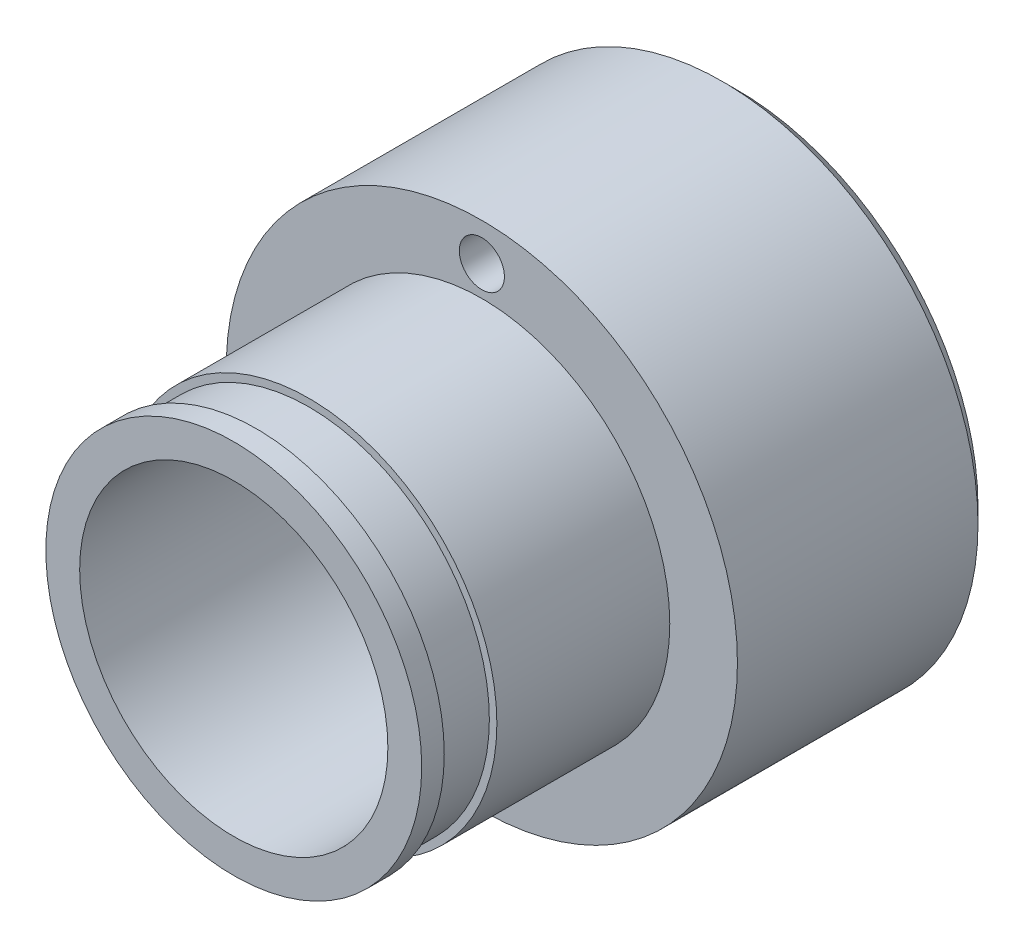
from build123d import *

# Parameters (mm, degrees)
ESQUISSE1_R                       = 17
BOSS_EXTRU_1_DEPTH                = 17
ESQUISSE2_R                       = 12.5
BOSS_EXTRU_2_DEPTH                = 11.5
ESQUISSE3_R                       = 12
BOSS_EXTRU_3_DEPTH                = 3.5
ESQUISSE4_R                       = 12.5
BOSS_EXTRU_4_DEPTH                = 1.5
ESQUISSE5_R                       = 10.25
ENL_V_MAT_EXTRU_1_DEPTH           = 30
ESQUISSE6_R                       = 10.25
ESQUISSE6_R_2                     = 6.75
ENL_V_MAT_EXTRU_2_DEPTH           = 1.5
ESQUISSE7_R                       = 12
ESQUISSE7_R_2                     = 10.25
ENL_V_MAT_EXTRU_3_DEPTH           = 2
DIAM_TRE_DU_PER_AGE_3_0_3_1_D     = 3
DIAM_TRE_DU_PER_AGE_3_0_3_1_DEPTH = 12
DIAM_TRE_DU_PER_AGE_3_0_3_1_TIP   = 0.901290929
CHANFREIN1_SIZE                   = 1


with BuildPart() as part:
    # Esquisse1 → Boss.-Extru.1 (new body)
    with BuildSketch(Plane.XY):
        Circle(ESQUISSE1_R)
    extrude(amount=BOSS_EXTRU_1_DEPTH)

    # Esquisse2 → Boss.-Extru.2 (add)
    with BuildSketch(Plane.XY.offset(17)):
        Circle(ESQUISSE2_R)
    extrude(amount=BOSS_EXTRU_2_DEPTH)

    # Esquisse3 → Boss.-Extru.3 (add)
    with BuildSketch(Plane.XY.offset(28.5)):
        Circle(ESQUISSE3_R)
    extrude(amount=BOSS_EXTRU_3_DEPTH)

    # Esquisse4 → Boss.-Extru.4 (add)
    with BuildSketch(Plane.XY.offset(32)):
        Circle(ESQUISSE4_R)
    extrude(amount=BOSS_EXTRU_4_DEPTH)

    # Esquisse5 → Enlèv. mat.-Extru.1 (cut)
    with BuildSketch(Plane.XY.offset(33.5)):
        Circle(ESQUISSE5_R)
    extrude(amount=-ENL_V_MAT_EXTRU_1_DEPTH, mode=Mode.SUBTRACT)

    # Esquisse6 → Enlèv. mat.-Extru.2 (cut)
    with BuildSketch(Plane.XY.offset(3.5)):
        Circle(ESQUISSE6_R)
        Circle(ESQUISSE6_R_2, mode=Mode.SUBTRACT)
    extrude(amount=-ENL_V_MAT_EXTRU_2_DEPTH, mode=Mode.SUBTRACT)

    # Esquisse7 → Enlèv. mat.-Extru.3 (cut)
    with BuildSketch(Plane.XY.offset(3.5)):
        Circle(ESQUISSE7_R)
        Circle(ESQUISSE7_R_2, mode=Mode.SUBTRACT)
    extrude(amount=ENL_V_MAT_EXTRU_3_DEPTH, mode=Mode.SUBTRACT)

    # Diamètre du perçage Ø3.0 (3)1
    with Locations(Plane.XY.offset(17)):
        with Locations((0, 14.5)):
            Hole(DIAM_TRE_DU_PER_AGE_3_0_3_1_D / 2, depth=DIAM_TRE_DU_PER_AGE_3_0_3_1_DEPTH)
            with Locations((0, 0, -(DIAM_TRE_DU_PER_AGE_3_0_3_1_DEPTH + DIAM_TRE_DU_PER_AGE_3_0_3_1_TIP / 2))):  # 118° drill point
                Cone(0, DIAM_TRE_DU_PER_AGE_3_0_3_1_D / 2, DIAM_TRE_DU_PER_AGE_3_0_3_1_TIP, mode=Mode.SUBTRACT)

    # Chanfrein1
    chanfrein1_edges = [part.edges().sort_by_distance(p)[0] for p in [
        (-17, 0, 0),
    ]]
    chamfer(chanfrein1_edges, length=CHANFREIN1_SIZE)


solid = part.part
